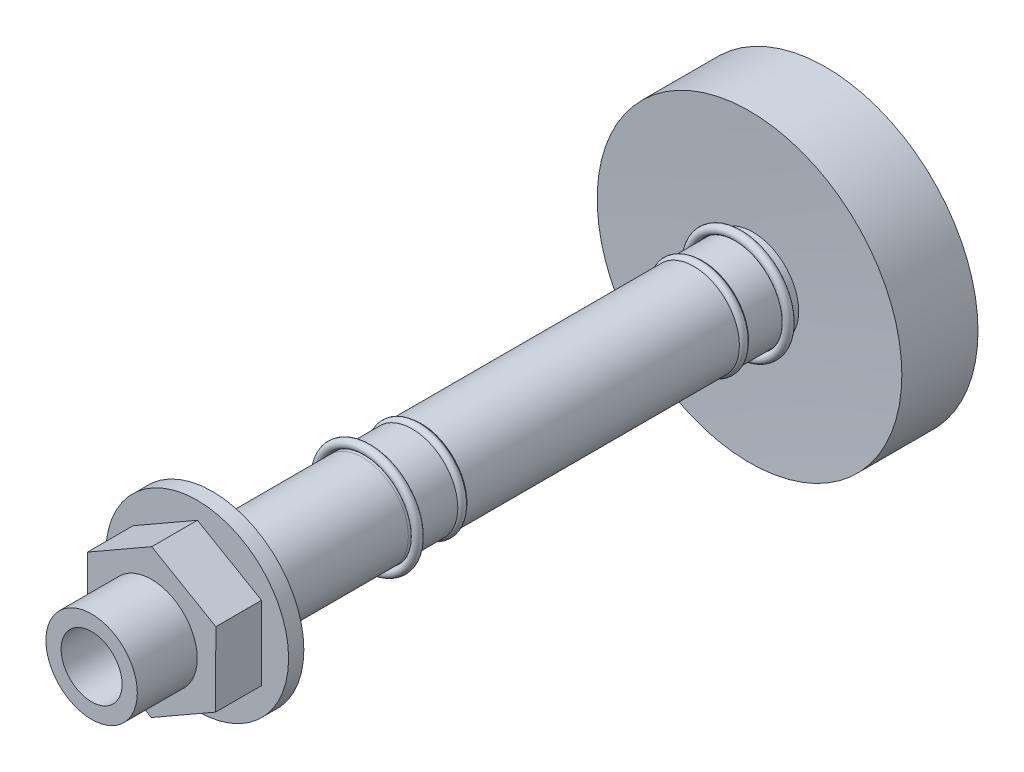
from build123d import *

# Parameters (mm, degrees)
SKETCH3_W          = 5
SKETCH3_H          = 12
SKETCH4_W          = 2
SKETCH4_H          = 3
SKETCH4_W_2        = 3
SKETCH4_H_2        = 2
SKETCH5_R          = 1.4
SKETCH6_R          = 30
CUT_EXTRUDE1_DEPTH = 15


with BuildPart() as part:
    # Sketch2 → Revolve1 (revolve)
    with BuildSketch(Plane(origin=(0, 0, 0), x_dir=(0, 0, -1), z_dir=(1, 0, 0))):
        with BuildLine():
            Line((-146.260266987, 10), (-54.196133493, 10))
            Line((-54.196133493, 10), (-54.196133493, 5.2))
            Line((-54.196133493, 5.2), (54.694863194, 5.2))
            Line((54.694863194, 5.2), (54.694863194, 10))
            Line((54.694863194, 10), (94.694863194, 10))
            Line((94.694863194, 10), (94.694863194, 50))
            Line((94.694863194, 50), (69.694863194, 50))
            ThreePointArc((69.694863194, 50), (70.394073941, 32.504146909), (70.839733013, 15))
            Line((70.839733013, 15), (-106.260266987, 15))
            ThreePointArc((-106.260266987, 15), (-106.400931952, 22.50063316), (-106.597861954, 30))
            Line((-106.597861954, 30), (-126.597861954, 30))
            Line((-126.597861954, 30), (-126.597861954, 15))
            Line((-126.597861954, 15), (-146.260266987, 15))
            Line((-146.260266987, 15), (-146.260266987, 10))
        make_face()
    revolve(axis=Axis((0, 0, 82.888204165), (0, 0, -1)))

    # Sketch4 → Cut-Revolve1 (revolve, cut)
    with BuildSketch(Plane(origin=(0, 0, 0), x_dir=(1, 0, 0), z_dir=(0, 1, 0))):
        Polygon((5.184385657, 46.135301631), (7.184385374, 46.134238031), (7.184385374, 43.134238031), (5.184385657, 43.134238031), align=None)
        with Locations((6.167094919, -47.548595943)):
            Rectangle(SKETCH4_W, SKETCH4_H)
        with Locations((14.000754593, 52.877721069)):
            Rectangle(SKETCH4_W, SKETCH4_H)
        with Locations((14.008215981, -39.551570131)):
            Rectangle(SKETCH4_W, SKETCH4_H)
        with Locations((16.499787217, -56.305136806)):
            Rectangle(SKETCH4_W_2, SKETCH4_H_2)
        with Locations((16.50645373, 66.364783933)):
            Rectangle(SKETCH4_W_2, SKETCH4_H_2)
    revolve(axis=Axis((0, 0, -31.338229239), (0, 0, 1)), mode=Mode.SUBTRACT)

    # Sketch6 → Cut-Extrude1 (cut)
    with BuildSketch(Plane.XY.offset(126.597861954)):
        Circle(SKETCH6_R)
        Polygon((21.030551331, -12.230533398), (21.10722829, 12.097725009), (0.076676959, 24.328258407), (-21.030551331, 12.230533398), (-21.10722829, -12.097725009), (-0.076676959, -24.328258407), align=None, mode=Mode.SUBTRACT)
    extrude(amount=-CUT_EXTRUDE1_DEPTH, mode=Mode.SUBTRACT)


with BuildPart() as body_2:
    # Sketch3 → Revolve2 (revolve)
    with BuildSketch(Plane(origin=(0, 0, 0), x_dir=(1, 0, 0), z_dir=(0, 1, 0))):
        with Locations((7.280352004, 55.48923141)):
            Rectangle(SKETCH3_W, SKETCH3_H)
        with Locations((7.437677798, -60.264530811)):
            Rectangle(SKETCH3_W, SKETCH3_H)
    revolve(axis=Axis((0, 0, -27.02221975), (0, 0, 1)))


with BuildPart() as body_3:
    # Sketch5 → Revolve3 (revolve)
    with BuildSketch(Plane(origin=(0, 0, 0), x_dir=(1, 0, 0), z_dir=(0, 1, 0))):
        with Locations((16.501027296, 65.894189595)):
            Circle(SKETCH5_R)
        with Locations((14.437473505, 52.886445358)):
            Circle(SKETCH5_R)
        with Locations((5.732191759, 44.657173232)):
            Circle(SKETCH5_R)
        with Locations((14.437473505, -39.567436543)):
            Circle(SKETCH5_R)
        with Locations((5.732191759, -47.562081473)):
            Circle(SKETCH5_R)
        with Locations((16.501027296, -55.857509039)):
            Circle(SKETCH5_R)
    revolve(axis=Axis((0, 0, -40.610181285), (0, 0, 1)))


solid = Compound([part.part, body_2.part, body_3.part])
